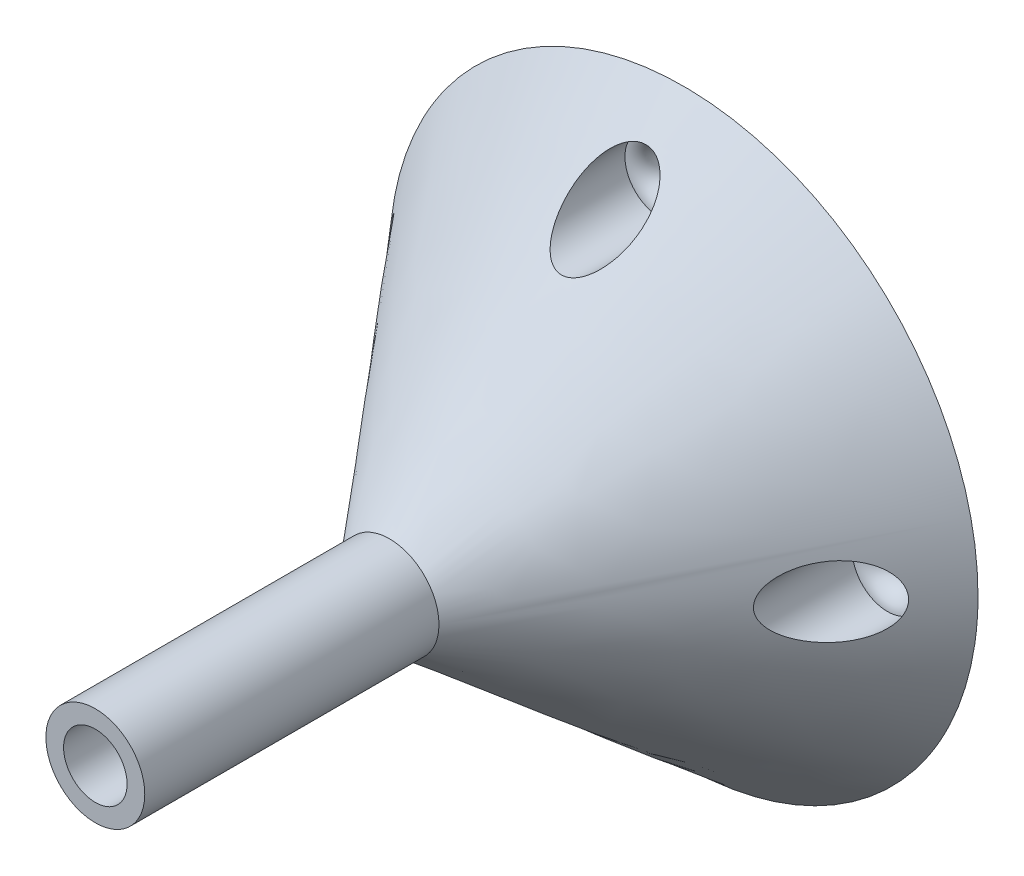
from build123d import *

# Parameters (mm, degrees)
SCHIZZO3_R                   = 4.2
ESTRUSIONE_ESTRUSIONE1_DEPTH = 25
SCHIZZO4_R                   = 1.6000000000000003
SCHIZZO4_R_2                 = 1.6000000000000016
TAGLIO_ESTRUSIONE1_DEPTH     = 25
SCHIZZO5_R                   = 2.9999999999999996
SCHIZZO5_R_2                 = 3.0000000000004285
SCHIZZO5_R_3                 = 3.000000000001174
SCHIZZO5_R_4                 = 3.0000000000008766
TAGLIO_ESTRUSIONE2_DEPTH     = 22.999999999999993
RACCORDO1_R                  = 1.5
RACCORDO2_R                  = 1.5
RACCORDO3_R                  = 1.5
RACCORDO4_R                  = 1.5
SCHIZZO6_R                   = 2.7
TAGLIO_ESTRUSIONE3_DEPTH     = 20.99999999999999
SCHIZZO7_R                   = 1.5999999999999994
TAGLIO_ESTRUSIONE4_DEPTH     = 20.99999999999999


with BuildPart() as part:
    # Loft1: read off the stored shape, not the designer's step
    # Loft1: loft between two sections, ruled curve by curve
    loft1_from = [
        Edge.make_bspline([(-24.22237273, 6.186813341, 0), (-36.595999412, -42.25793212, 0), (11.848746049, -54.631558801, 0), (24.22237273, -6.186813341, 0), (36.595999412, 42.25793212, 0), (-11.848746049, 54.631558801, 0), (-24.22237273, 6.186813341, 0)], [0, 0, 0, 0, 0.5, 0.5, 0.5, 1, 1, 1, 1], 3, [1, 0.333333333333333, 0.333333333333333, 1, 0.333333333333333, 0.333333333333333, 1]),
    ]
    loft1_to = [
        Edge.make_bspline([(-3.742227402, 1.906760099, 25), (-7.555747599, -5.577694704, 25), (-0.071292796, -9.391214902, 25), (3.742227402, -1.906760099, 25), (7.555747599, 5.577694704, 25), (0.071292796, 9.391214902, 25), (-3.742227402, 1.906760099, 25)], [0, 0, 0, 0, 0.5, 0.5, 0.5, 1, 1, 1, 1], 3, [1, 0.333333333333333, 0.333333333333333, 1, 0.333333333333333, 0.333333333333333, 1]),
    ]
    loft1 = Solid(Shell([*[Face.make_surface_from_curves(loft1_from[k], loft1_to[k]) for k in range(1)], Face(Wire(loft1_from)), Face(Wire(loft1_to))]))
    add(loft1)

    # Schizzo3 → Estrusione-Estrusione1 (add)
    with BuildSketch(Plane.XY.offset(25)):
        with Locations(Location((0, 0, 0), (0, 0, 153))):
            Circle(SCHIZZO3_R)
    extrude(amount=ESTRUSIONE_ESTRUSIONE1_DEPTH)

    # Schizzo4 → Taglio-Estrusione1 (cut)
    with BuildSketch(Plane.XY.offset(25)):
        with Locations((0, 19.31473002952617)):
            Circle(SCHIZZO4_R)
        with Locations((19.314730029526658, 4.888e-13)):
            Circle(SCHIZZO4_R_2)
        with Locations((9.7759e-13, -19.31473002952617)):
            Circle(SCHIZZO4_R)
        with Locations((-19.314730029525684, -4.9116e-13)):
            Circle(SCHIZZO4_R_2)
    extrude(amount=-TAGLIO_ESTRUSIONE1_DEPTH, mode=Mode.SUBTRACT)

    # Schizzo5 → Taglio-Estrusione2 (cut)
    with BuildSketch(Plane.XY.offset(25)):
        with Locations((0, 19.31473002952617)):
            Circle(SCHIZZO5_R)
        with Locations((19.314730029526718, 5.4659e-13)):
            Circle(SCHIZZO5_R_2)
        with Locations((1.09318e-12, -19.31473002952617)):
            Circle(SCHIZZO5_R_3)
        with Locations((-19.314730029525627, -5.4896e-13)):
            Circle(SCHIZZO5_R_4)
    extrude(amount=-TAGLIO_ESTRUSIONE2_DEPTH, mode=Mode.SUBTRACT)

    # Raccordo1
    # the kernel refuses this fillet: 1.5 mm, written as the material it takes off along each edge
    with BuildSketch(Plane(origin=(-19.314730029525684, -4.9116e-13, 2.000000000000007), x_dir=(1, 0, 0), z_dir=(0, -1, 0))) as raccordo1_piece_1:
        with BuildLine():
            CenterArc((3.1000000000000014, -1.496662954709631), RACCORDO1_R, 93.82255372924298, 86.17744627075702)
            Line((1.6000000000000014, -1.496662954709631), (1.5700000000000003, -1.496662954709631))
            Line((1.5700000000000003, -1.496662954709631), (1.5700000000000003, 0))
            Line((1.5700000000000003, 0), (1.6000000000000014, 0.0299999999999998))
            ThreePointArc((1.6000000000000014, 0.0299999999999998), (2.3000000000004093, 0.0299999999999998), (2.998000000000836, 0.02993325909419253))
            Line((2.998000000000836, 0.02993325909419253), (3.0000000000008207, 0))
        make_face()
    revolve(axis=Axis((-19.314730029525684, -4.9116e-13, 2.000000000000007), (0, 0, 1)), mode=Mode.SUBTRACT)

    # Raccordo2
    # the kernel refuses this fillet: 1.5 mm, written as the material it takes off along each edge
    with BuildSketch(Plane(origin=(0, 19.31473002952617, 2.000000000000007), x_dir=(1, 0, 0), z_dir=(0, -1, 0))) as raccordo2_piece_1:
        with BuildLine():
            CenterArc((3.1000000000000005, -1.4966629547095778), RACCORDO2_R, 93.82255372927438, 86.17744627072562)
            Line((2.9999999999999996, -1.33e-15), (2.9979999999999993, 0.02993325909419031))
            ThreePointArc((2.9979999999999993, 0.02993325909419031), (2.3, 0.0299999999999998), (1.6000000000000003, 0.0299999999999998))
            Line((1.6000000000000003, 0.0299999999999998), (1.5700000000000003, 0))
            Line((1.5700000000000003, 0), (1.5700000000000005, -1.4966629547095778))
            Line((1.5700000000000005, -1.4966629547095778), (1.6000000000000005, -1.4966629547095778))
        make_face()
    revolve(axis=Axis((0, 19.31473002952617, 2.000000000000007), (0, 0, 1)), mode=Mode.SUBTRACT)

    # Raccordo3
    # the kernel refuses this fillet: 1.5 mm, written as the material it takes off along each edge
    with BuildSketch(Plane(origin=(19.314730029526658, 4.888e-13, 2.000000000000007), x_dir=(1, 0, 0), z_dir=(0, -1, 0))) as raccordo3_piece_1:
        with BuildLine():
            CenterArc((3.1000000000000014, -1.4966629547096026), RACCORDO3_R, 93.82255372926026, 86.17744627073972)
            Line((3.0000000000003695, -1.78e-15), (2.9980000000003777, 0.02993325909419031))
            ThreePointArc((2.9980000000003777, 0.02993325909419031), (2.3000000000001855, 0.0299999999999998), (1.6000000000000014, 0.0299999999999998))
            Line((1.6000000000000014, 0.0299999999999998), (1.5700000000000003, 0))
            Line((1.5700000000000003, 0), (1.5700000000000003, -1.4966629547096026))
            Line((1.5700000000000003, -1.4966629547096026), (1.6000000000000014, -1.4966629547096026))
        make_face()
    revolve(axis=Axis((19.314730029526658, 4.888e-13, 2.000000000000007), (0, 0, 1)), mode=Mode.SUBTRACT)

    # Raccordo4
    # the kernel refuses this fillet: 1.5 mm, written as the material it takes off along each edge
    with BuildSketch(Plane(origin=(9.7759e-13, -19.31473002952617, 2.000000000000007), x_dir=(1, 0, 0), z_dir=(0, -1, 0))) as raccordo4_piece_1:
        with BuildLine():
            CenterArc((3.1, -1.4966629547096488), RACCORDO4_R, 93.82255372923383, 86.17744627076615)
            Line((3.0000000000010583, -1.78e-15), (2.9980000000010794, 0.0299332590941912))
            ThreePointArc((2.9980000000010794, 0.0299332590941912), (2.300000000000529, 0.0299999999999998), (1.6000000000000003, 0.0299999999999998))
            Line((1.6000000000000003, 0.0299999999999998), (1.5700000000000003, 0))
            Line((1.5700000000000003, 0), (1.5700000000000003, -1.4966629547096488))
            Line((1.5700000000000003, -1.4966629547096488), (1.6000000000000003, -1.4966629547096488))
        make_face()
    revolve(axis=Axis((9.7759e-13, -19.31473002952617, 2.000000000000007), (0, 0, 1)), mode=Mode.SUBTRACT)

    # Schizzo6 → Taglio-Estrusione3 (cut)
    with BuildSketch(Plane.XY.offset(50)):
        Circle(SCHIZZO6_R)
    extrude(amount=-TAGLIO_ESTRUSIONE3_DEPTH, mode=Mode.SUBTRACT)

    # Schizzo7 → Taglio-Estrusione4 (cut)
    with BuildSketch(Plane(origin=(0, 0, 0), x_dir=(1, 0, 0), z_dir=(0, 1, 0))):
        with Locations(Location((0, -44.73839719336523, 0), (0, 0, 270))):
            Circle(SCHIZZO7_R)
    extrude(amount=-TAGLIO_ESTRUSIONE4_DEPTH, mode=Mode.SUBTRACT)


solid = part.part
